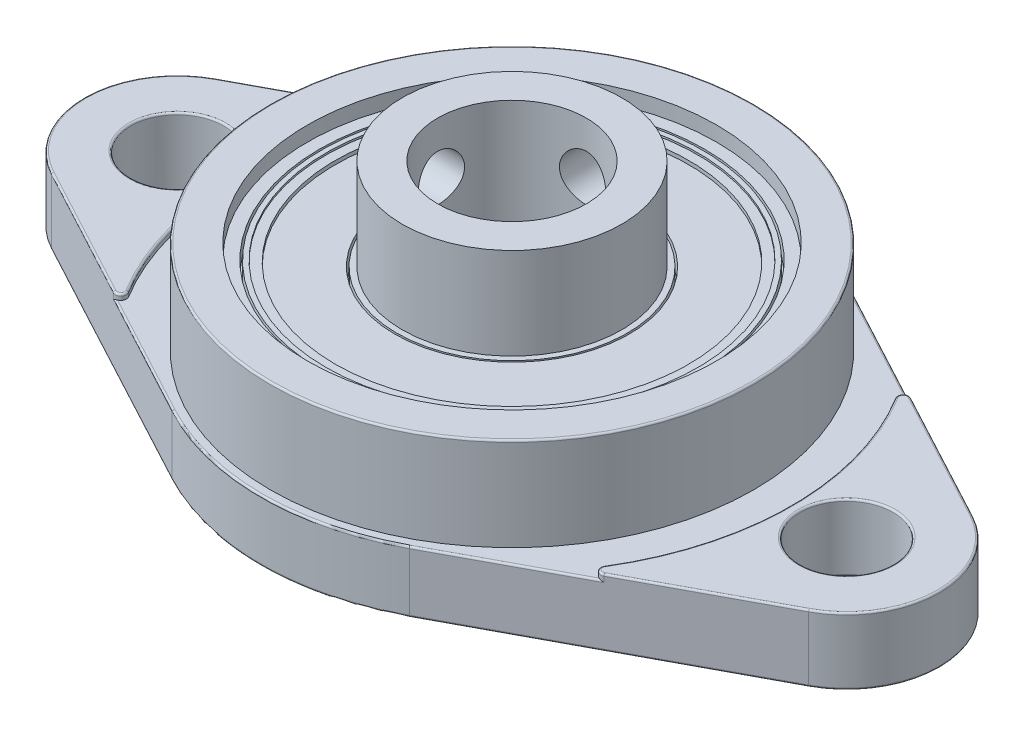
from build123d import *

# Parameters (mm, degrees)
SKETCH_1_R           = 2.4999999999999982
SKETCH_1_R_2         = 4
EXTRUDE_1_DEPTH      = 3.3
SKETCH_2_R           = 2.4999999999999982
EXTRUDE_2_DEPTH      = 0.3
SKETCH_3_R           = 13
SKETCH_3_R_2         = 4
EXTRUDE_3_DEPTH      = 5
SKETCH_4_R           = 11
CUT_EXTRUDE_1_DEPTH  = 0.8
SKETCH_5_R           = 10.35
SKETCH_5_R_2         = 10.25
CUT_EXTRUDE_2_DEPTH  = 0.8
SKETCH_6_R           = 10
CUT_EXTRUDE_3_DEPTH  = 0.1
SKETCH_7_R           = 9.5
CUT_EXTRUDE_4_DEPTH  = 0.2
SKETCH_8_R           = 5.9
SKETCH_8_R_2         = 4
EXTRUDE_4_DEPTH      = 4.92
SKETCH_9_R           = 6.300000000000002
SKETCH_9_R_2         = 6.200000000000002
CUT_EXTRUDE_5_DEPTH  = 1
FILLET_1_R           = 0.1
SKETCH_10_R          = 1.2499999999999998
CUT_EXTRUDE_6_DEPTH  = 9.000000000000002
SKETCH_11_R          = 1.2499999999999998
CUT_EXTRUDE_7_DEPTH  = 9.000000000000002
SKETCH_12_R          = 10.375
CUT_EXTRUDE_8_DEPTH  = 0.6
SKETCH_13_R          = 9.675
SKETCH_13_R_2        = 9.575000000000001
CUT_EXTRUDE_9_DEPTH  = 1
CUT_EXTRUDE_START    = -1
SKETCH_14_R          = 6.200000000000001
SKETCH_14_R_2        = 6
CUT_EXTRUDE_10_DEPTH = 1
CUT_EXTRUDE_11_DEPTH = 3


with BuildPart() as part:
    # 草图1 → 凸台-拉伸1 (new body)
    with BuildSketch(Plane(origin=(0, 0, 0), x_dir=(1, 0, 0), z_dir=(0, 1, 0))):
        with BuildLine():
            Line((-6.375000000000001, 11.899973739466821), (-20.361111111111107, 4.4073976812840066))
            ThreePointArc((-20.361111111111107, 4.4073976812840066), (-22.999999999999996, -6.1e-16), (-20.361111111111107, -4.4073976812840066))
            Line((-20.361111111111107, -4.4073976812840066), (-6.375000000000001, -11.899973739466821))
            ThreePointArc((-6.375000000000001, -11.899973739466821), (8.3e-16, -13.499999999999998), (6.375000000000001, -11.899973739466821))
            Line((6.375000000000001, -11.899973739466821), (20.361111111111107, -4.4073976812840066))
            ThreePointArc((20.361111111111107, -4.4073976812840066), (22.999999999999996, 0), (20.361111111111107, 4.4073976812840066))
            Line((20.361111111111107, 4.4073976812840066), (6.375000000000001, 11.899973739466821))
            ThreePointArc((6.375000000000001, 11.899973739466821), (8.3e-16, 13.499999999999998), (-6.375000000000001, 11.899973739466821))
        make_face()
        with Locations((18, 0)):
            Circle(SKETCH_1_R, mode=Mode.SUBTRACT)
        with Locations((-18, 0)):
            Circle(SKETCH_1_R, mode=Mode.SUBTRACT)
        Circle(SKETCH_1_R_2, mode=Mode.SUBTRACT)
    extrude(amount=EXTRUDE_1_DEPTH)

    # 草图2 → 凸台-拉伸2 (add)
    # profile 1 of 2: a face of its own
    with BuildSketch(Plane(origin=(0, 3.3, 0), x_dir=(1, 0, 0), z_dir=(0, 1, 0))):
        with BuildLine():
            Line((-13.194370897996713, 8.246731267968991), (-20.361111111111107, 4.4073976812840066))
            ThreePointArc((-20.361111111111107, 4.4073976812840066), (-22.999999999999996, 6.1e-16), (-20.361111111111107, -4.407397681284008))
            Line((-20.361111111111107, -4.407397681284008), (-13.194370897996707, -8.246731267968995))
            ThreePointArc((-13.194370897996707, -8.246731267968995), (-12.834607881846445, -8.188282509805415), (-12.796768854245139, -7.825771967737208))
            ThreePointArc((-12.796768854245139, -7.825771967737208), (-15.000000000000002, 1.84e-15), (-12.796768854245144, 7.825771967737206))
            ThreePointArc((-12.796768854245144, 7.825771967737206), (-12.834607881846452, 8.188282509805411), (-13.194370897996713, 8.246731267968991))
        make_face()
        with Locations((-18, 0)):
            Circle(SKETCH_2_R, mode=Mode.SUBTRACT)
    # profile 2 of 2: a face of its own
    with BuildSketch(Plane(origin=(0, 3.3, 0), x_dir=(1, 0, 0), z_dir=(0, 1, 0))):
        with BuildLine():
            Line((13.194370897996707, -8.246731267968991), (20.361111111111107, -4.4073976812840066))
            ThreePointArc((20.361111111111107, -4.4073976812840066), (22.999999999999996, 0), (20.361111111111107, 4.407397681284007))
            Line((20.361111111111107, 4.407397681284007), (13.194370897996711, 8.246731267968993))
            ThreePointArc((13.194370897996711, 8.246731267968993), (12.83460788184645, 8.188282509805413), (12.796768854245142, 7.825771967737208))
            ThreePointArc((12.796768854245142, 7.825771967737208), (14.999999999999998, 0), (12.79676885424514, -7.825771967737206))
            ThreePointArc((12.79676885424514, -7.825771967737206), (12.834607881846448, -8.18828250980541), (13.194370897996707, -8.246731267968991))
        make_face()
        with Locations((18, 0)):
            Circle(SKETCH_2_R, mode=Mode.SUBTRACT)
    extrude(amount=EXTRUDE_2_DEPTH)

    # 草图3 → 凸台-拉伸3 (add)
    with BuildSketch(Plane(origin=(0, 3.3, 0), x_dir=(1, 0, 0), z_dir=(0, 1, 0))):
        Circle(SKETCH_3_R)
        Circle(SKETCH_3_R_2, mode=Mode.SUBTRACT)
    extrude(amount=EXTRUDE_3_DEPTH)

    # 草图4 → 切除-拉伸1 (cut)
    with BuildSketch(Plane(origin=(0, 8.3, 0), x_dir=(1, 0, 0), z_dir=(0, 1, 0))):
        Circle(SKETCH_4_R)
    extrude(amount=-CUT_EXTRUDE_1_DEPTH, mode=Mode.SUBTRACT)

    # 草图5 → 切除-拉伸2 (cut)
    with BuildSketch(Plane(origin=(0, 7.5, 0), x_dir=(1, 0, 0), z_dir=(0, 1, 0))):
        Circle(SKETCH_5_R)
        Circle(SKETCH_5_R_2, mode=Mode.SUBTRACT)
    extrude(amount=-CUT_EXTRUDE_2_DEPTH, mode=Mode.SUBTRACT)

    # 草图6 → 切除-拉伸3 (cut)
    with BuildSketch(Plane(origin=(0, 7.5, 0), x_dir=(1, 0, 0), z_dir=(0, 1, 0))):
        Circle(SKETCH_6_R)
    extrude(amount=-CUT_EXTRUDE_3_DEPTH, mode=Mode.SUBTRACT)

    # 草图7 → 切除-拉伸4 (cut)
    with BuildSketch(Plane(origin=(0, 7.3999999999999995, 0), x_dir=(1, 0, 0), z_dir=(0, 1, 0))):
        Circle(SKETCH_7_R)
    extrude(amount=-CUT_EXTRUDE_4_DEPTH, mode=Mode.SUBTRACT)

    # 草图8 → 凸台-拉伸4 (add)
    with BuildSketch(Plane(origin=(0, 7.2, 0), x_dir=(1, 0, 0), z_dir=(0, 1, 0))):
        Circle(SKETCH_8_R)
        Circle(SKETCH_8_R_2, mode=Mode.SUBTRACT)
    extrude(amount=EXTRUDE_4_DEPTH)

    # 草图9 → 切除-拉伸5 (cut)
    with BuildSketch(Plane(origin=(0, 7.2, 0), x_dir=(1, 0, 0), z_dir=(0, 1, 0))):
        Circle(SKETCH_9_R)
        Circle(SKETCH_9_R_2, mode=Mode.SUBTRACT)
    extrude(amount=-CUT_EXTRUDE_5_DEPTH, mode=Mode.SUBTRACT)

    # 圆角1
    fillet_1_edges = [part.edges().sort_by_distance(p)[0] for p in [
        (-9.784685448998356, 3.3, -10.073352503717906),
        (2.2e-16, 3.3, -13.499999999999998),
        (-9.784685448998353, 3.3, 10.073352503717906),
        (2.2e-16, 3.3, 13.500000000000004),
        (-22.999999999999996, 0, 4.4e-16),
        (-13.368055555555554, 0, -8.153685710375413),
        (2.2e-16, 0, -13.499999999999998),
        (13.368055555555554, 0, -8.153685710375413),
        (22.999999999999996, 0, -4.4e-16),
        (13.368055555555554, 0, 8.153685710375413),
        (2.2e-16, 0, 13.500000000000004),
        (12.83460788184645, 3.5999999999999996, -8.188282509805415),
        (16.77774100455391, 3.5999999999999996, -6.3270644746265),
        (22.999999999999996, 3.5999999999999996, -6.7e-16),
        (16.777741004553906, 3.5999999999999996, 6.327064474626499),
        (12.83460788184645, 3.5999999999999996, 8.18828250980541),
        (-12.834607881846445, 3.5999999999999996, 8.188282509805415),
        (-16.777741004553906, 3.5999999999999996, 6.327064474626502),
        (-22.999999999999996, 3.5999999999999996, 8.9e-16),
        (-16.77774100455391, 3.5999999999999996, -6.327064474626499),
        (-12.834607881846452, 3.5999999999999996, -8.188282509805413),
        (-20.5, 3.5999999999999996, -3.1e-16),
        (15.500000000000002, 3.5999999999999996, -3.1e-16),
        (15.500000000000002, 0, -3.1e-16),
        (9.784685448998356, 3.3, -10.073352503717906),
        (9.784685448998355, 3.3, 10.073352503717908),
        (-13.368055555555554, 0, 8.153685710375413),
        (-13, 8.3, 4.18e-15),
        (15, 3.5999999999999996, -1.78e-15),
        (-15.000000000000004, 3.5999999999999996, 1.11e-15),
    ]]
    fillet(fillet_1_edges, radius=FILLET_1_R)

    # 草图10 → 切除-拉伸6 (cut)
    with BuildSketch(Plane(origin=(0, 0, 0), x_dir=(0, 0, -1), z_dir=(1, 0, 0))):
        with Locations((0, 9.319999999999999)):
            Circle(SKETCH_10_R)
    extrude(amount=-CUT_EXTRUDE_6_DEPTH, mode=Mode.SUBTRACT)

    # 草图11 → 切除-拉伸7 (cut)
    with BuildSketch(Plane.XY):
        with Locations((0, 9.319999999999999)):
            Circle(SKETCH_11_R)
    extrude(amount=-CUT_EXTRUDE_7_DEPTH, mode=Mode.SUBTRACT)

    # 草图12 → 切除-拉伸8 (cut)
    with BuildSketch(Plane.XZ):
        with BuildLine():
            Line((-16.272415816740114, 5.0095361950733786), (-5.713888888888887, 10.665902388707298))
            ThreePointArc((-5.713888888888887, 10.665902388707298), (7.4e-16, 12.099999999999998), (5.713888888888887, 10.6659023887073))
            Line((5.713888888888887, 10.6659023887073), (16.272415816740114, 5.0095361950733786))
            ThreePointArc((16.272415816740114, 5.0095361950733786), (16.43023994705205, 4.727620570544039), (16.24070508242207, 4.465969255714202))
            ThreePointArc((16.24070508242207, 4.465969255714202), (13.2, 4.85e-15), (16.240705082422064, -4.465969255714199))
            ThreePointArc((16.240705082422064, -4.465969255714199), (16.430239947052044, -4.727620570544034), (16.27241581674011, -5.009536195073376))
            Line((16.27241581674011, -5.009536195073376), (5.713888888888887, -10.665902388707297))
            ThreePointArc((5.713888888888887, -10.665902388707297), (7.4e-16, -12.099999999999998), (-5.713888888888889, -10.665902388707298))
            Line((-5.713888888888889, -10.665902388707298), (-16.272415816740114, -5.009536195073379))
            ThreePointArc((-16.272415816740114, -5.009536195073379), (-16.43023994705205, -4.7276205705440395), (-16.24070508242207, -4.465969255714202))
            ThreePointArc((-16.24070508242207, -4.465969255714202), (-13.2, 0), (-16.24070508242207, 4.465969255714202))
            ThreePointArc((-16.24070508242207, 4.465969255714202), (-16.43023994705205, 4.727620570544039), (-16.272415816740114, 5.0095361950733786))
        make_face()
        Circle(SKETCH_12_R, mode=Mode.SUBTRACT)
    extrude(amount=-CUT_EXTRUDE_8_DEPTH, mode=Mode.SUBTRACT)

    # 草图13 → 切除-拉伸9 (cut)
    with BuildSketch(Plane.XZ):
        Circle(SKETCH_13_R)
        Circle(SKETCH_13_R_2, mode=Mode.SUBTRACT)
    extrude(amount=-CUT_EXTRUDE_9_DEPTH, mode=Mode.SUBTRACT)

    # 草图14 → 切除-拉伸10 (cut)
    with BuildSketch(Plane.XZ.offset(CUT_EXTRUDE_START)):
        Circle(SKETCH_14_R)
        Circle(SKETCH_14_R_2, mode=Mode.SUBTRACT)
    extrude(amount=CUT_EXTRUDE_10_DEPTH, mode=Mode.SUBTRACT)

    # 草图15 → 切除-拉伸11 (cut)
    with BuildSketch(Plane.XZ.offset(-0.6)):
        with BuildLine():
            Line((-10.163445527969344, 4.699999999999997), (-9.249358085834935, 4.699999999999997))
            ThreePointArc((-9.249358085834935, 4.699999999999997), (-10.375000000000002, -3.34e-15), (-9.249358085834933, -4.699999999999998))
            Line((-9.249358085834933, -4.699999999999998), (-10.163445527969342, -4.699999999999998))
            ThreePointArc((-10.163445527969342, -4.699999999999998), (-10.328132795730175, -4.65075506742132), (-10.438753307508016, -4.5191873589164775))
            ThreePointArc((-10.438753307508016, -4.5191873589164775), (-11.375000000000002, -3.66e-15), (-10.438753307508017, 4.519187358916476))
            ThreePointArc((-10.438753307508017, 4.519187358916476), (-10.328132795730177, 4.650755067421319), (-10.163445527969344, 4.699999999999997))
        make_face()
        with BuildLine():
            Line((9.249358085834935, -4.699999999999993), (10.163445527969342, -4.699999999999993))
            ThreePointArc((10.163445527969342, -4.699999999999993), (10.328132795730175, -4.650755067421315), (10.438753307508016, -4.519187358916472))
            ThreePointArc((10.438753307508016, -4.519187358916472), (11.374999999999998, 6.3e-16), (10.438753307508016, 4.519187358916473))
            ThreePointArc((10.438753307508016, 4.519187358916473), (10.328132795730177, 4.650755067421317), (10.163445527969344, 4.699999999999995))
            Line((10.163445527969344, 4.699999999999995), (9.249358085834935, 4.699999999999995))
            ThreePointArc((9.249358085834935, 4.699999999999995), (10.375000000000002, 1.15e-15), (9.249358085834935, -4.699999999999993))
        make_face()
    extrude(amount=-CUT_EXTRUDE_11_DEPTH, mode=Mode.SUBTRACT)


solid = part.part
